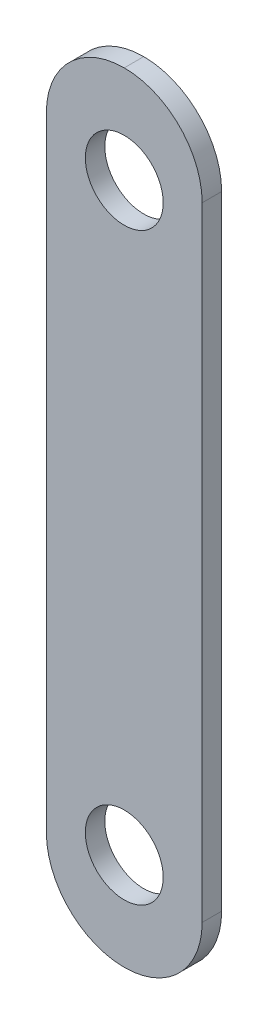
from build123d import *

# Parameters (mm, degrees)
SKETCH1_W           = 4
SKETCH1_H           = 20
SKETCH1_R           = 1
BOSS_EXTRUDE1_DEPTH = 0.5
FILLET1_R           = 2
FILLET2_R           = 2
FILLET3_R           = 2
FILLET4_R           = 2


with BuildPart() as part:
    # Sketch1 → Boss-Extrude1 (new body)
    with BuildSketch(Plane.XY):
        with Locations((2, 10)):
            Rectangle(SKETCH1_W, SKETCH1_H)
        with Locations((2, 17.5)):
            Circle(SKETCH1_R, mode=Mode.SUBTRACT)
        with Locations((2, 2.5)):
            Circle(SKETCH1_R, mode=Mode.SUBTRACT)
    extrude(amount=BOSS_EXTRUDE1_DEPTH)

    # Fillet1
    fillet1_edges = [part.edges().sort_by_distance(p)[0] for p in [
        (4, 0, 0.25),
    ]]
    fillet(fillet1_edges, radius=FILLET1_R)

    # Fillet2
    fillet2_edges = [part.edges().sort_by_distance(p)[0] for p in [
        (0, 0, 0.25),
    ]]
    fillet(fillet2_edges, radius=FILLET2_R - 0.0001)  # a hair under: the kernel refuses the full size

    # Fillet3
    fillet3_edges = [part.edges().sort_by_distance(p)[0] for p in [
        (0, 20, 0.25),
    ]]
    fillet(fillet3_edges, radius=FILLET3_R)

    # Fillet4
    fillet4_edges = [part.edges().sort_by_distance(p)[0] for p in [
        (4, 20, 0.25),
    ]]
    fillet(fillet4_edges, radius=FILLET4_R - 0.0001)  # a hair under: the kernel refuses the full size


solid = part.part
